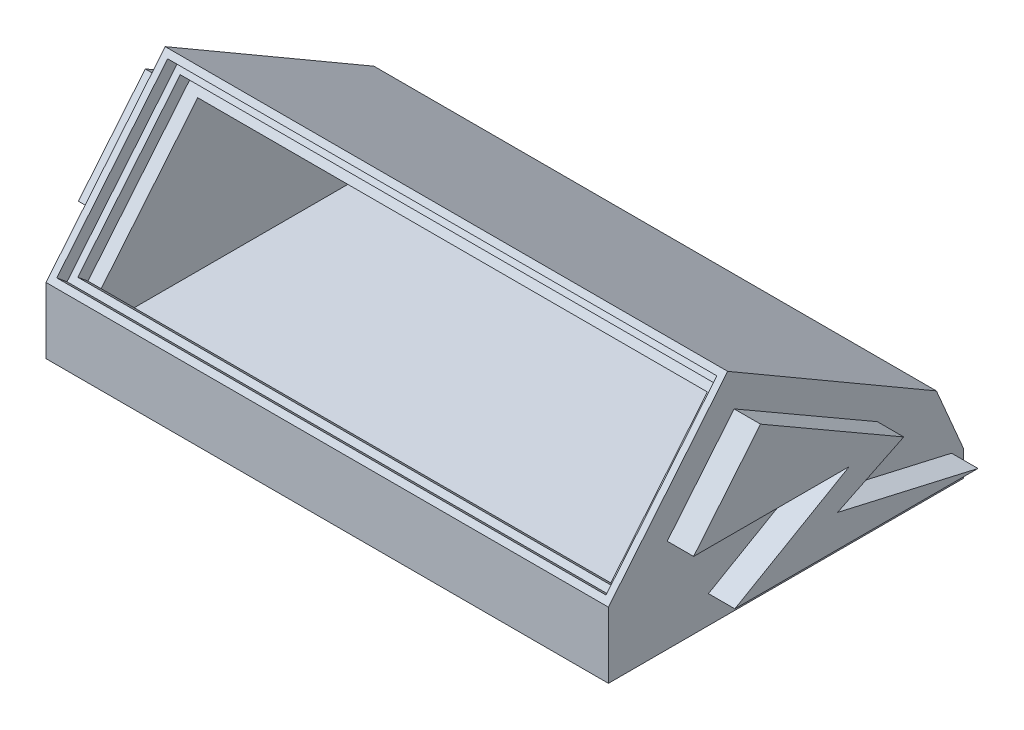
from build123d import *

# Parameters (mm, degrees)
BOSS_EXTRUDE1_DEPTH = 106.5
BOSS_EXTRUDE3_DEPTH = 10
CUT_EXTRUDE1_DEPTH  = 96.5
SKETCH7_W           = 208
SKETCH7_H           = 65.975887641
CUT_EXTRUDE4_DEPTH  = 5
SKETCH8_W           = 203
SKETCH8_H           = 60.975887641
CUT_EXTRUDE5_DEPTH  = 5


with BuildPart() as part:
    # Sketch1 → Boss-Extrude1 (new, symmetric)
    with BuildSketch(Plane(origin=(0, 0, 0), x_dir=(0, 0, -1), z_dir=(1, 0, 0))):
        Polygon((-49, -28), (49, -28), (49, -18), (38.813808257, 5.820680996), (-40.236231744, 51.757125112), (-85.394108974, -3), (-85.394108974, -28), align=None)
    extrude(amount=BOSS_EXTRUDE1_DEPTH, both=True)

    # Sketch2 → Boss-Extrude3 (add)
    with BuildSketch(Plane.ZY.offset(106.5)):
        Polygon((63.124778203, 7.5), (37.789875065, 38.220364772), (-16.454560202, 6.902325468), (8.617937693, -5.326348832), (-44.57407659, -17.5), (47.508845683, -17.5), (4.207575494, 7.5), align=None)
    boss_extrude3 = extrude(amount=BOSS_EXTRUDE3_DEPTH)

    # Mirror1: Boss-Extrude3 across plane
    add(boss_extrude3.mirror(Plane(origin=(0, 0, 0), x_dir=(0, 0, 1), z_dir=(1, 0, 0))))

    # Sketch3 → Cut-Extrude1 (cut, symmetric)
    with BuildSketch(Plane(origin=(0, 0, 0), x_dir=(0, 0, -1), z_dir=(1, 0, 0))):
        Polygon((38.124069778, -18), (30.922798991, -1.159636252), (-37.921741102, 38.846331723), (-75.394108974, -6.591568852), (-75.394108974, -18), align=None)
    extrude(amount=CUT_EXTRUDE1_DEPTH, both=True, mode=Mode.SUBTRACT)

    # Sketch7 → Cut-Extrude4 (cut)
    with BuildSketch(Plane(origin=(0, 40.70164154, 49.35362366), x_dir=(1, 0, 0), z_dir=(0, 0.6362425146167643, 0.7714891202046446))):
        with Locations((0, -21.157886168)):
            Rectangle(SKETCH7_W, SKETCH7_H)
    extrude(amount=-CUT_EXTRUDE4_DEPTH, mode=Mode.SUBTRACT)

    # Sketch8 → Cut-Extrude5 (cut)
    with BuildSketch(Plane(origin=(0, 37.520428967, 45.496178059), x_dir=(1, 0, 0), z_dir=(0, 0.6362425146167641, 0.7714891202046447))):
        with Locations((0, -21.157886168)):
            Rectangle(SKETCH8_W, SKETCH8_H)
    extrude(amount=-CUT_EXTRUDE5_DEPTH, mode=Mode.SUBTRACT)


solid = part.part
